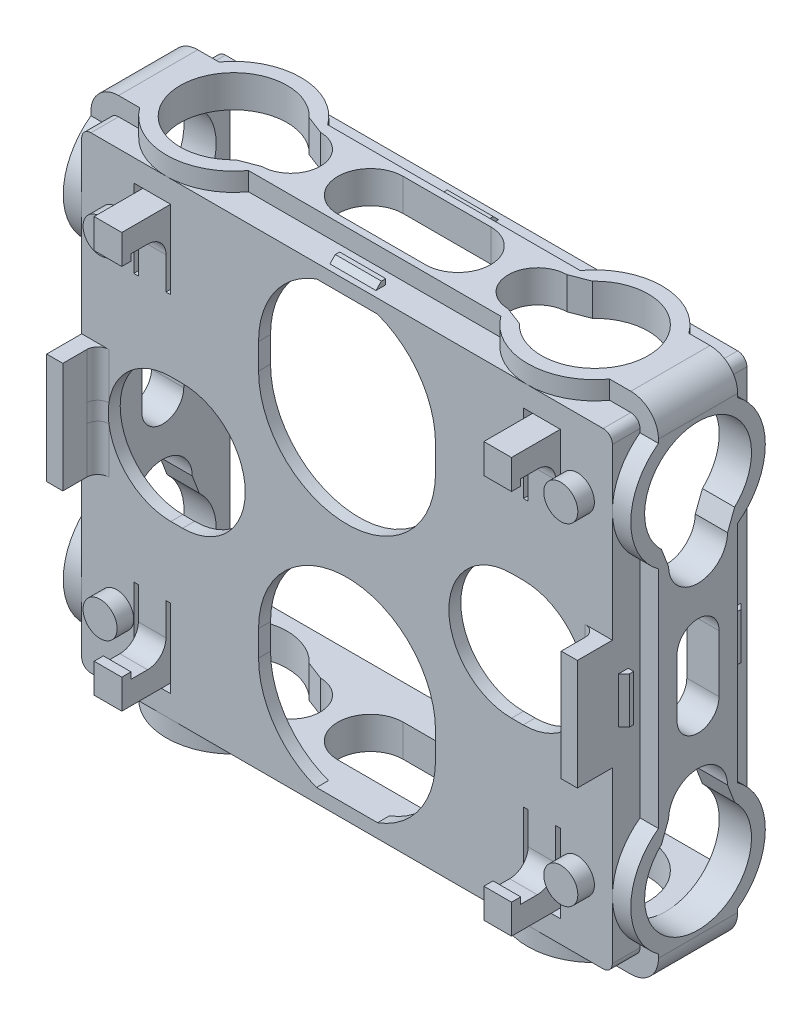
from build123d import *
from build123d.topology import SkipClean

# Parameters (mm, degrees)
SKETCH_2_W          = 61.6
SKETCH_2_H          = 54.8
EXTRUDE_1_DEPTH     = 1.5
SKETCH_2_4_R        = 1.849118688
EXTRUDE_3_DEPTH     = 3.3
SKETCH_6_W          = 14.6
SKETCH_6_H          = 54.8
EXTRUDE_4_DEPTH     = 3.5
EXTRUDE_START       = -3.5
SKETCH_9_W          = 14.6
SKETCH_9_H          = 54.8
EXTRUDE_6_DEPTH     = 3.5
SKETCH_10_W         = 61.6
SKETCH_10_H         = 14.6
EXTRUDE_7_DEPTH     = 3.5
SKETCH_11_W         = 61.6
SKETCH_11_H         = 14.6
EXTRUDE_8_DEPTH     = 3.5
FILLET_1_R          = 3
CUT_EXTRUDE_START   = -3
CUT_EXTRUDE_1_DEPTH = 3
CUT_EXTRUDE_2_DEPTH = 3
EXTRUDE_9_DEPTH     = 2
EXTRUDE_START_2     = -2
EXTRUDE_10_DEPTH    = 2
EXTRUDE_11_DEPTH    = 2
EXTRUDE_12_DEPTH    = 2
EXTRUDE_13_DEPTH    = 2.5
EXTRUDE_14_DEPTH    = 2.5
SKETCH_28_W         = 1.75
SKETCH_28_H         = 12
SKETCH_28_W_2       = 3
SKETCH_28_H_2       = 2.5
EXTRUDE_15_DEPTH    = 3.8
SKETCH_29_W         = 3
SKETCH_29_H         = 3.2
EXTRUDE_16_DEPTH    = 1
CUT_EXTRUDE_4_DEPTH = 1.5
CUT_EXTRUDE_5_DEPTH = 0.2
FILLET_2_R          = 2
FILLET_3_R          = 1.2


with BuildPart() as part:
    # ｽｹｯﾁ2 → ﾎﾞｽ - 押し出し1 (new body)
    with BuildSketch(Plane.XY):
        with Locations((27, 20)):
            Rectangle(SKETCH_2_W, SKETCH_2_H)
        with BuildLine():
            Line((17.396467493, 32.098090349), (17.396467493, 34.884847493))
            ThreePointArc((17.396467493, 34.884847493), (27, 44.48838), (36.603532507, 34.884847493))
            Line((36.603532507, 34.884847493), (36.603532507, 32.098090349))
            ThreePointArc((36.603532507, 32.098090349), (27, 22.494557841), (17.396467493, 32.098090349))
        make_face(mode=Mode.SUBTRACT)
        with BuildLine():
            Line((17.396467493, 7.901909651), (17.396467493, 5.115152507))
            ThreePointArc((17.396467493, 5.115152507), (27, -4.48838), (36.603532507, 5.115152507))
            Line((36.603532507, 5.115152507), (36.603532507, 7.901909651))
            ThreePointArc((36.603532507, 7.901909651), (27, 17.505442159), (17.396467493, 7.901909651))
        make_face(mode=Mode.SUBTRACT)
        with BuildLine():
            Line((46.11976018, 13.198097812), (44.853626262, 13.198097812))
            ThreePointArc((44.853626262, 13.198097812), (38.051724073, 20), (44.853626262, 26.801902188))
            Line((44.853626262, 26.801902188), (46.11976018, 26.801902188))
            ThreePointArc((46.11976018, 26.801902188), (52.921662369, 20), (46.11976018, 13.198097812))
        make_face(mode=Mode.SUBTRACT)
        with BuildLine():
            Line((7.88023982, 13.198097812), (9.146373738, 13.198097812))
            ThreePointArc((9.146373738, 13.198097812), (15.948275927, 20), (9.146373738, 26.801902188))
            Line((9.146373738, 26.801902188), (7.88023982, 26.801902188))
            ThreePointArc((7.88023982, 26.801902188), (1.078337631, 20), (7.88023982, 13.198097812))
        make_face(mode=Mode.SUBTRACT)
    extrude(amount=EXTRUDE_1_DEPTH)

    # ｽｹｯﾁ2<4> → ﾎﾞｽ - 押し出し3 (add)
    with BuildSketch(Plane.XY):
        with Locations(Location((2, 38, 0), (0, 0, 180))):
            Circle(SKETCH_2_4_R)
        with Locations(Location((2, 2, 0), (0, 0, 180))):
            Circle(SKETCH_2_4_R)
        with Locations(Location((52, 2, 0), (0, 0, 180))):
            Circle(SKETCH_2_4_R)
        with Locations(Location((52, 38, 0), (0, 0, 180))):
            Circle(SKETCH_2_4_R)
    extrude(amount=EXTRUDE_3_DEPTH)

    # ｽｹｯﾁ6 → ﾎﾞｽ - 押し出し4 (add)
    with BuildSketch(Plane.ZY.offset(3.8)):
        with Locations((-5.8, 20)):
            Rectangle(SKETCH_6_W, SKETCH_6_H)
        with BuildLine():
            Line((-3.521492008, 23.1), (-3.521492008, 16.9))
            ThreePointArc((-3.521492008, 16.9), (-5.8, 14.621492008), (-8.078507992, 16.9))
            Line((-8.078507992, 16.9), (-8.078507992, 23.1))
            ThreePointArc((-8.078507992, 23.1), (-5.8, 25.378507992), (-3.521492008, 23.1))
        make_face(mode=Mode.SUBTRACT)
        with BuildLine():
            Line((-9.770178394, 33.871799021), (-8.999779069, 31.862398009))
            ThreePointArc((-8.999779069, 31.862398009), (-5.8, 28.7), (-2.600220931, 31.862398009))
            Line((-2.600220931, 31.862398009), (-1.829821606, 33.871799021))
            ThreePointArc((-1.829821606, 33.871799021), (-5.8, 43.9), (-9.770178394, 33.871799021))
        make_face(mode=Mode.SUBTRACT)
        with BuildLine():
            Line((-2.600220931, 8.137601991), (-1.829821606, 6.128200979))
            ThreePointArc((-1.829821606, 6.128200979), (-5.8, -3.9), (-9.770178394, 6.128200979))
            Line((-9.770178394, 6.128200979), (-8.999779069, 8.137601991))
            ThreePointArc((-8.999779069, 8.137601991), (-5.8, 11.3), (-2.600220931, 8.137601991))
        make_face(mode=Mode.SUBTRACT)
    extrude(amount=-EXTRUDE_4_DEPTH)

    # ｽｹｯﾁ9 → ﾎﾞｽ - 押し出し6 (add)
    with BuildSketch(Plane(origin=(57.8, 0, 0), x_dir=(0, 0, -1), z_dir=(1, 0, 0)).offset(EXTRUDE_START)):
        with Locations((5.8, 20)):
            Rectangle(SKETCH_9_W, SKETCH_9_H)
        with BuildLine():
            Line((8.999779069, 31.862398009), (9.770178394, 33.871799021))
            ThreePointArc((9.770178394, 33.871799021), (5.8, 43.9), (1.829821606, 33.871799021))
            Line((1.829821606, 33.871799021), (2.600220931, 31.862398009))
            ThreePointArc((2.600220931, 31.862398009), (5.8, 28.7), (8.999779069, 31.862398009))
        make_face(mode=Mode.SUBTRACT)
        with BuildLine():
            Line((2.600220931, 8.137601991), (1.829821606, 6.128200979))
            ThreePointArc((1.829821606, 6.128200979), (5.8, -3.9), (9.770178394, 6.128200979))
            Line((9.770178394, 6.128200979), (8.999779069, 8.137601991))
            ThreePointArc((8.999779069, 8.137601991), (5.8, 11.3), (2.600220931, 8.137601991))
        make_face(mode=Mode.SUBTRACT)
        with BuildLine():
            Line((3.521492008, 23.1), (3.521492008, 16.9))
            ThreePointArc((3.521492008, 16.9), (5.8, 14.621492008), (8.078507992, 16.9))
            Line((8.078507992, 16.9), (8.078507992, 23.1))
            ThreePointArc((8.078507992, 23.1), (5.8, 25.378507992), (3.521492008, 23.1))
        make_face(mode=Mode.SUBTRACT)
    extrude(amount=EXTRUDE_6_DEPTH)

    # ｽｹｯﾁ10 → ﾎﾞｽ - 押し出し7 (add)
    with BuildSketch(Plane.XZ.offset(7.4)):
        with Locations((27, -5.8)):
            Rectangle(SKETCH_10_W, SKETCH_10_H)
        with BuildLine():
            Line((22.25, -2.25), (31.75, -2.25))
            ThreePointArc((31.75, -2.25), (35.3, -5.8), (31.75, -9.35))
            Line((31.75, -9.35), (22.25, -9.35))
            ThreePointArc((22.25, -9.35), (18.7, -5.8), (22.25, -2.25))
        make_face(mode=Mode.SUBTRACT)
        with BuildLine():
            Line((11.628200979, -9.770178394), (13.637601991, -8.999779069))
            ThreePointArc((13.637601991, -8.999779069), (16.8, -5.8), (13.637601991, -2.600220931))
            Line((13.637601991, -2.600220931), (11.628200979, -1.829821606))
            ThreePointArc((11.628200979, -1.829821606), (1.6, -5.8), (11.628200979, -9.770178394))
        make_face(mode=Mode.SUBTRACT)
        with BuildLine():
            Line((40.362398009, -2.600220931), (42.371799021, -1.829821606))
            ThreePointArc((42.371799021, -1.829821606), (52.4, -5.8), (42.371799021, -9.770178394))
            Line((42.371799021, -9.770178394), (40.362398009, -8.999779069))
            ThreePointArc((40.362398009, -8.999779069), (37.2, -5.8), (40.362398009, -2.600220931))
        make_face(mode=Mode.SUBTRACT)
    extrude(amount=-EXTRUDE_7_DEPTH)

    # ｽｹｯﾁ11 → ﾎﾞｽ - 押し出し8 (add)
    with BuildSketch(Plane(origin=(0, 47.4, 0), x_dir=(1, 0, 0), z_dir=(0, 1, 0)).offset(EXTRUDE_START)):
        with Locations((27, 5.8)):
            Rectangle(SKETCH_11_W, SKETCH_11_H)
        with BuildLine():
            Line((40.362398009, 2.600220931), (42.371799021, 1.829821606))
            ThreePointArc((42.371799021, 1.829821606), (52.4, 5.8), (42.371799021, 9.770178394))
            Line((42.371799021, 9.770178394), (40.362398009, 8.999779069))
            ThreePointArc((40.362398009, 8.999779069), (37.2, 5.8), (40.362398009, 2.600220931))
        make_face(mode=Mode.SUBTRACT)
        with BuildLine():
            Line((13.637601991, 8.999779069), (11.628200979, 9.770178394))
            ThreePointArc((11.628200979, 9.770178394), (1.6, 5.8), (11.628200979, 1.829821606))
            Line((11.628200979, 1.829821606), (13.637601991, 2.600220931))
            ThreePointArc((13.637601991, 2.600220931), (16.8, 5.8), (13.637601991, 8.999779069))
        make_face(mode=Mode.SUBTRACT)
        with BuildLine():
            Line((22.25, 2.25), (31.75, 2.25))
            ThreePointArc((31.75, 2.25), (35.3, 5.8), (31.75, 9.35))
            Line((31.75, 9.35), (22.25, 9.35))
            ThreePointArc((22.25, 9.35), (18.7, 5.8), (22.25, 2.25))
        make_face(mode=Mode.SUBTRACT)
    extrude(amount=EXTRUDE_8_DEPTH)

    # ﾌｨﾚｯﾄ1
    fillet_1_edges = [part.edges().sort_by_distance(p)[0] for p in [
        (57.8, 47.4, -5.8),
        (-3.8, 47.4, -5.8),
        (-3.8, -7.4, -5.8),
        (57.8, -7.4, -5.8),
    ]]
    fillet(fillet_1_edges, radius=FILLET_1_R)

    # ｽｹｯﾁ12 → ｶｯﾄ - 押し出し1 (cut)
    with BuildSketch(Plane(origin=(0, 0, -13.1), x_dir=(-1, 0, 0), z_dir=(0, 0, -1)).offset(CUT_EXTRUDE_START)):
        with BuildLine():
            Line((-54.8, -7.4), (0.8, -7.4))
            ThreePointArc((0.8, -7.4), (2.921320344, -6.521320344), (3.8, -4.4))
            Line((3.8, -4.4), (3.8, 44.4))
            ThreePointArc((3.8, 44.4), (2.921320344, 46.521320344), (0.8, 47.4))
            Line((0.8, 47.4), (-54.8, 47.4))
            ThreePointArc((-54.8, 47.4), (-56.921320344, 46.521320344), (-57.8, 44.4))
            Line((-57.8, 44.4), (-57.8, -4.4))
            ThreePointArc((-57.8, -4.4), (-56.921320344, -6.521320344), (-54.8, -7.4))
        make_face()
        with BuildLine():
            Line((-55.8, 44.4), (-55.8, -4.4))
            ThreePointArc((-55.8, -4.4), (-55.507106781, -5.107106781), (-54.8, -5.4))
            Line((-54.8, -5.4), (0.8, -5.4))
            ThreePointArc((0.8, -5.4), (1.507106781, -5.107106781), (1.8, -4.4))
            Line((1.8, -4.4), (1.8, 44.4))
            ThreePointArc((1.8, 44.4), (1.507106781, 45.107106781), (0.8, 45.4))
            Line((0.8, 45.4), (-54.8, 45.4))
            ThreePointArc((-54.8, 45.4), (-55.507106781, 45.107106781), (-55.8, 44.4))
        make_face(mode=Mode.SUBTRACT)
    extrude(amount=CUT_EXTRUDE_1_DEPTH, mode=Mode.SUBTRACT)

    # ｽｹｯﾁ22 → ｶｯﾄ - 押し出し2 (cut)
    with BuildSketch(Plane.XY.offset(1.5)):
        with BuildLine():
            Line((-3.8, 44.4), (-3.8, -4.4))
            ThreePointArc((-3.8, -4.4), (-2.921320344, -6.521320344), (-0.8, -7.4))
            Line((-0.8, -7.4), (54.8, -7.4))
            ThreePointArc((54.8, -7.4), (56.921320344, -6.521320344), (57.8, -4.4))
            Line((57.8, -4.4), (57.8, 44.4))
            ThreePointArc((57.8, 44.4), (56.921320344, 46.521320344), (54.8, 47.4))
            Line((54.8, 47.4), (-0.8, 47.4))
            ThreePointArc((-0.8, 47.4), (-2.921320344, 46.521320344), (-3.8, 44.4))
        make_face()
        with BuildLine():
            Line((-1.8, 44.4), (-1.8, -4.4))
            ThreePointArc((-1.8, -4.4), (-1.507106781, -5.107106781), (-0.8, -5.4))
            Line((-0.8, -5.4), (54.8, -5.4))
            ThreePointArc((54.8, -5.4), (55.507106781, -5.107106781), (55.8, -4.4))
            Line((55.8, -4.4), (55.8, 44.4))
            ThreePointArc((55.8, 44.4), (55.507106781, 45.107106781), (54.8, 45.4))
            Line((54.8, 45.4), (-0.8, 45.4))
            ThreePointArc((-0.8, 45.4), (-1.507106781, 45.107106781), (-1.8, 44.4))
        make_face(mode=Mode.SUBTRACT)
    extrude(amount=-CUT_EXTRUDE_2_DEPTH, mode=Mode.SUBTRACT)

    # ｽｹｯﾁ21 → ﾎﾞｽ - 押し出し9 (add)
    with SkipClean():  # the faces are left unmerged after this step: merging them gives an invalid solid
        with BuildSketch(Plane.XZ.offset(7.4)):
            with BuildLine():
                Line((1.500847518, -10.1), (3.507699909, -10.1))
                ThreePointArc((3.507699909, -10.1), (7.4, -11.6), (11.292300091, -10.1))
                Line((11.292300091, -10.1), (13.299152482, -10.1))
                ThreePointArc((13.299152482, -10.1), (7.4, -13.1), (1.500847518, -10.1))
            make_face()
            with BuildLine():
                Line((11.292300091, -1.5), (13.299152482, -1.5))
                ThreePointArc((13.299152482, -1.5), (7.4, 1.5), (1.500847518, -1.5))
                Line((1.500847518, -1.5), (3.507699909, -1.5))
                ThreePointArc((3.507699909, -1.5), (7.4, 0), (11.292300091, -1.5))
            make_face()
            with BuildLine():
                Line((42.707699909, -10.1), (40.700847518, -10.1))
                ThreePointArc((40.700847518, -10.1), (46.6, -13.1), (52.499152482, -10.1))
                Line((52.499152482, -10.1), (50.492300091, -10.1))
                ThreePointArc((50.492300091, -10.1), (46.6, -11.6), (42.707699909, -10.1))
            make_face()
            with BuildLine():
                Line((52.499152482, -1.5), (50.492300091, -1.5))
                ThreePointArc((50.492300091, -1.5), (46.6, 0), (42.707699909, -1.5))
                Line((42.707699909, -1.5), (40.700847518, -1.5))
                ThreePointArc((40.700847518, -1.5), (46.6, 1.5), (52.499152482, -1.5))
            make_face()
        extrude(amount=-EXTRUDE_9_DEPTH)

    # ｽｹｯﾁ23 → ﾎﾞｽ - 押し出し10 (add)
    with SkipClean():  # the faces are left unmerged after this step: merging them gives an invalid solid
        with BuildSketch(Plane(origin=(0, 47.4, 0), x_dir=(1, 0, 0), z_dir=(0, 1, 0)).offset(EXTRUDE_START_2)):
            with BuildLine():
                Line((1.500847518, 10.1), (3.507699909, 10.1))
                ThreePointArc((3.507699909, 10.1), (7.4, 11.6), (11.292300091, 10.1))
                Line((11.292300091, 10.1), (13.299152482, 10.1))
                ThreePointArc((13.299152482, 10.1), (7.4, 13.1), (1.500847518, 10.1))
            make_face()
            with BuildLine():
                Line((52.499152482, 1.5), (50.492300091, 1.5))
                ThreePointArc((50.492300091, 1.5), (46.6, 0), (42.707699909, 1.5))
                Line((42.707699909, 1.5), (40.700847518, 1.5))
                ThreePointArc((40.700847518, 1.5), (46.6, -1.5), (52.499152482, 1.5))
            make_face()
            with BuildLine():
                Line((40.700847518, 10.1), (42.707699909, 10.1))
                ThreePointArc((42.707699909, 10.1), (46.6, 11.6), (50.492300091, 10.1))
                Line((50.492300091, 10.1), (52.499152482, 10.1))
                ThreePointArc((52.499152482, 10.1), (46.6, 13.1), (40.700847518, 10.1))
            make_face()
            with BuildLine():
                Line((13.299152482, 1.5), (11.292300091, 1.5))
                ThreePointArc((11.292300091, 1.5), (7.4, 0), (3.507699909, 1.5))
                Line((3.507699909, 1.5), (1.500847518, 1.5))
                ThreePointArc((1.500847518, 1.5), (7.4, -1.5), (13.299152482, 1.5))
            make_face()
        extrude(amount=EXTRUDE_10_DEPTH)

    # ｽｹｯﾁ24 → ﾎﾞｽ - 押し出し11 (add)
    with SkipClean():  # the faces are left unmerged after this step: merging them gives an invalid solid
        with BuildSketch(Plane(origin=(57.8, 0, 0), x_dir=(0, 0, -1), z_dir=(1, 0, 0)).offset(EXTRUDE_START_2)):
            with BuildLine():
                Line((1.5, 41.992300091), (1.5, 43.999152482))
                ThreePointArc((1.5, 43.999152482), (-1.5, 38.1), (1.5, 32.200847518))
                Line((1.5, 32.200847518), (1.5, 34.207699909))
                ThreePointArc((1.5, 34.207699909), (0, 38.1), (1.5, 41.992300091))
            make_face()
            with BuildLine():
                Line((10.1, 32.200847518), (10.1, 34.207699909))
                ThreePointArc((10.1, 34.207699909), (11.6, 38.1), (10.1, 41.992300091))
                Line((10.1, 41.992300091), (10.1, 43.999152482))
                ThreePointArc((10.1, 43.999152482), (13.1, 38.1), (10.1, 32.200847518))
            make_face()
            with BuildLine():
                Line((10.1, -1.992300091), (10.1, -3.999152482))
                ThreePointArc((10.1, -3.999152482), (13.1, 1.9), (10.1, 7.799152482))
                Line((10.1, 7.799152482), (10.1, 5.792300091))
                ThreePointArc((10.1, 5.792300091), (11.6, 1.9), (10.1, -1.992300091))
            make_face()
            with BuildLine():
                Line((1.5, 7.799152482), (1.5, 5.792300091))
                ThreePointArc((1.5, 5.792300091), (0, 1.9), (1.5, -1.992300091))
                Line((1.5, -1.992300091), (1.5, -3.999152482))
                ThreePointArc((1.5, -3.999152482), (-1.5, 1.9), (1.5, 7.799152482))
            make_face()
        extrude(amount=EXTRUDE_11_DEPTH)

    # ｽｹｯﾁ25 → ﾎﾞｽ - 押し出し12 (add)
    with SkipClean():  # the faces are left unmerged after this step: merging them gives an invalid solid
        with BuildSketch(Plane.ZY.offset(3.8)):
            with BuildLine():
                Line((-1.5, 43.999152482), (-1.5, 41.992300091))
                ThreePointArc((-1.5, 41.992300091), (0, 38.1), (-1.5, 34.207699909))
                Line((-1.5, 34.207699909), (-1.5, 32.200847518))
                ThreePointArc((-1.5, 32.200847518), (1.5, 38.1), (-1.5, 43.999152482))
            make_face()
            with BuildLine():
                Line((-1.5, 7.799152482), (-1.5, 5.792300091))
                ThreePointArc((-1.5, 5.792300091), (0, 1.9), (-1.5, -1.992300091))
                Line((-1.5, -1.992300091), (-1.5, -3.999152482))
                ThreePointArc((-1.5, -3.999152482), (1.5, 1.9), (-1.5, 7.799152482))
            make_face()
            with BuildLine():
                Line((-10.1, -3.999152482), (-10.1, -1.992300091))
                ThreePointArc((-10.1, -1.992300091), (-11.6, 1.9), (-10.1, 5.792300091))
                Line((-10.1, 5.792300091), (-10.1, 7.799152482))
                ThreePointArc((-10.1, 7.799152482), (-13.1, 1.9), (-10.1, -3.999152482))
            make_face()
            with BuildLine():
                Line((-10.1, 32.200847518), (-10.1, 34.207699909))
                ThreePointArc((-10.1, 34.207699909), (-11.6, 38.1), (-10.1, 41.992300091))
                Line((-10.1, 41.992300091), (-10.1, 43.999152482))
                ThreePointArc((-10.1, 43.999152482), (-13.1, 38.1), (-10.1, 32.200847518))
            make_face()
        extrude(amount=-EXTRUDE_12_DEPTH)

    # ｽｹｯﾁ26 → ﾎﾞｽ - 押し出し13 (add, symmetric)
    with SkipClean():  # the faces are left unmerged after this step: merging them gives an invalid solid
        with BuildSketch(Plane(origin=(0, 20, 0), x_dir=(1, 0, 0), z_dir=(0, 1, 0))):
            Polygon((56.388664164, -0.246601917), (56.388664164, 0.223398083), (55.8, 0.223398083), (55.8, -0.835266081), align=None)
            Polygon((55.8, 11.376601917), (56.388664164, 11.376601917), (56.388664164, 11.846601917), (55.8, 12.435266081), align=None)
            Polygon((-2.388664164, 11.846601917), (-2.388664164, 11.376601917), (-1.8, 11.376601917), (-1.8, 12.435266081), align=None)
            Polygon((-1.8, 0.223398083), (-2.388664164, 0.223398083), (-2.388664164, -0.246601917), (-1.8, -0.835266081), align=None)
        extrude(amount=EXTRUDE_13_DEPTH, both=True)

    # ｽｹｯﾁ27 → ﾎﾞｽ - 押し出し14 (add, symmetric)
    with SkipClean():  # the faces are left unmerged after this step: merging them gives an invalid solid
        with BuildSketch(Plane.ZY.offset(-27)):
            Polygon((0.271335836, 45.988664164), (-0.198664164, 45.988664164), (-0.198664164, 45.4), (0.86, 45.4), align=None)
            Polygon((-11.401335836, 45.4), (-12.46, 45.4), (-11.871335836, 45.988664164), (-11.401335836, 45.988664164), align=None)
            Polygon((-11.401335836, -5.4), (-11.401335836, -5.988664164), (-11.871335836, -5.988664164), (-12.46, -5.4), align=None)
            Polygon((-0.198664164, -5.988664164), (-0.198664164, -5.4), (0.86, -5.4), (0.271335836, -5.988664164), align=None)
        extrude(amount=EXTRUDE_14_DEPTH, both=True)

    # ｽｹｯﾁ28 → ﾎﾞｽ - 押し出し15 (add)
    with SkipClean():  # the faces are left unmerged after this step: merging them gives an invalid solid
        with BuildSketch(Plane.XY.offset(1.5)):
            with Locations((-0.925, 20)):
                Rectangle(SKETCH_28_W, SKETCH_28_H)
            with Locations((54.925, 20)):
                Rectangle(SKETCH_28_W, SKETCH_28_H)
            with Locations((5.85, 41.25)):
                Rectangle(SKETCH_28_W_2, SKETCH_28_H_2)
            with Locations((5.85, -1.25)):
                Rectangle(SKETCH_28_W_2, SKETCH_28_H_2)
            with Locations((48.15, -1.25)):
                Rectangle(SKETCH_28_W_2, SKETCH_28_H_2)
            with Locations((48.15, 41.25)):
                Rectangle(SKETCH_28_W_2, SKETCH_28_H_2)
        extrude(amount=EXTRUDE_15_DEPTH)

    # ｽｹｯﾁ29 → ﾎﾞｽ - 押し出し16 (add)
    with SkipClean():  # the faces are left unmerged after this step: merging them gives an invalid solid
        with BuildSketch(Plane.XY.offset(5.3)):
            with Locations((5.85, 40.9)):
                Rectangle(SKETCH_29_W, SKETCH_29_H)
            with Locations((5.85, -0.9)):
                Rectangle(SKETCH_29_W, SKETCH_29_H)
            with Locations((48.15, -0.9)):
                Rectangle(SKETCH_29_W, SKETCH_29_H)
            with Locations((48.15, 40.9)):
                Rectangle(SKETCH_29_W, SKETCH_29_H)
        extrude(amount=EXTRUDE_16_DEPTH)

    # ｽｹｯﾁ30 → ｶｯﾄ - 押し出し4 (cut)
    with SkipClean():  # the faces are left unmerged after this step: merging them gives an invalid solid
        with BuildSketch(Plane.XY.offset(1.5)):
            Polygon((4.35, 42.5), (4.35, 34.5), (3.85, 34.5), (3.85, 43), (7.85, 43), (7.85, 34.5), (7.35, 34.5), (7.35, 42.5), align=None)
            Polygon((7.35, 5.5), (7.85, 5.5), (7.85, -3), (3.85, -3), (3.85, 5.5), (4.35, 5.5), (4.35, -2.5), (7.35, -2.5), align=None)
            Polygon((49.65, -2.5), (49.65, 5.5), (50.15, 5.5), (50.15, -3), (46.15, -3), (46.15, 5.5), (46.65, 5.5), (46.65, -2.5), align=None)
            Polygon((46.65, 34.5), (46.15, 34.5), (46.15, 43), (50.15, 43), (50.15, 34.5), (49.65, 34.5), (49.65, 42.5), (46.65, 42.5), align=None)
        extrude(amount=-CUT_EXTRUDE_4_DEPTH, mode=Mode.SUBTRACT)

    # ｽｹｯﾁ31 → ｶｯﾄ - 押し出し5 (cut)
    with SkipClean():  # the faces are left unmerged after this step: merging them gives an invalid solid
        with BuildSketch(Plane(origin=(0, 0, 0), x_dir=(-1, 0, 0), z_dir=(0, 0, -1))):
            with BuildLine():
                Line((0.3, -3.9), (0.3, 1.9))
                Line((0.3, 1.9), (0.3, 38.1))
                Line((0.3, 38.1), (0.3, 43.9))
                Line((0.3, 43.9), (-7.4, 43.9))
                Line((-7.4, 43.9), (-23.690187032, 43.9))
                ThreePointArc((-23.690187032, 43.9), (-19.125556114, 40.382207777), (-17.396467493, 34.884847493))
                Line((-17.396467493, 34.884847493), (-17.396467493, 32.098090349))
                ThreePointArc((-17.396467493, 32.098090349), (-27, 22.494557841), (-36.603532507, 32.098090349))
                Line((-36.603532507, 32.098090349), (-36.603532507, 34.884847493))
                ThreePointArc((-36.603532507, 34.884847493), (-34.874443886, 40.382207777), (-30.309812968, 43.9))
                Line((-30.309812968, 43.9), (-46.6, 43.9))
                Line((-46.6, 43.9), (-54.3, 43.9))
                Line((-54.3, 43.9), (-54.3, 38.1))
                Line((-54.3, 38.1), (-54.3, 1.9))
                Line((-54.3, 1.9), (-54.3, -3.9))
                Line((-54.3, -3.9), (-46.6, -3.9))
                Line((-46.6, -3.9), (-30.309812968, -3.9))
                ThreePointArc((-30.309812968, -3.9), (-34.874443886, -0.382207777), (-36.603532507, 5.115152507))
                Line((-36.603532507, 5.115152507), (-36.603532507, 7.901909651))
                ThreePointArc((-36.603532507, 7.901909651), (-27, 17.505442159), (-17.396467493, 7.901909651))
                Line((-17.396467493, 7.901909651), (-17.396467493, 5.115152507))
                ThreePointArc((-17.396467493, 5.115152507), (-19.125556114, -0.382207777), (-23.690187032, -3.9))
                Line((-23.690187032, -3.9), (-7.4, -3.9))
                Line((-7.4, -3.9), (0.3, -3.9))
            make_face()
        extrude(amount=-CUT_EXTRUDE_5_DEPTH, mode=Mode.SUBTRACT)

    # ﾌｨﾚｯﾄ2
    fillet_2_edges = [part.edges().sort_by_distance(p)[0] for p in [
        (5.85, 40, 1.5),
        (5.85, 0, 1.5),
        (48.15, 0, 1.5),
        (48.15, 40, 1.5),
    ]]
    fillet(fillet_2_edges, radius=FILLET_2_R)

    # ﾌｨﾚｯﾄ3
    fillet_3_edges = [part.edges().sort_by_distance(p)[0] for p in [
        (54.05, 20, 1.5),
        (-0.05, 20, 1.5),
    ]]
    fillet(fillet_3_edges, radius=FILLET_3_R)


solid = part.part
